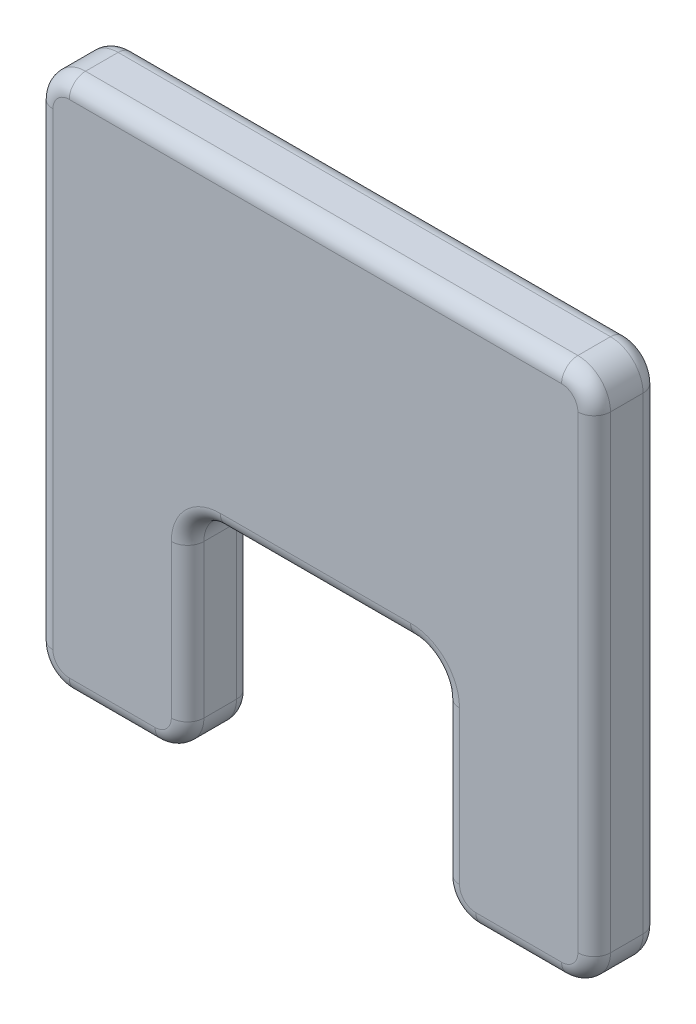
from build123d import *

# Parameters (mm, degrees)
BOSS_EXTRUDE1_DEPTH = 50.8
FILLET1_R           = 25.4
FILLET2_R           = 12.7


with BuildPart() as part:
    # Sketch1 → Boss-Extrude1 (new body)
    with BuildSketch(Plane.XY):
        Polygon((-93.295534025, 185.662148834), (341.304465963, 185.662148834), (341.304465963, -230.262851166), (223.626687979, -230.262851166), (223.626687979, -60.262851166), (24.382243959, -60.262851166), (24.382243959, -230.262851166), (-93.295534025, -230.262851166), align=None)
    extrude(amount=BOSS_EXTRUDE1_DEPTH)

    # Fillet1
    fillet1_edges = [part.edges().sort_by_distance(p)[0] for p in [
        (24.382243959, -230.262851166, 25.4),
        (-93.295534025, -230.262851166, 25.4),
        (-93.295534025, 185.662148834, 25.4),
        (341.304465963, 185.662148834, 25.4),
        (341.304465963, -230.262851166, 25.4),
        (223.626687979, -230.262851166, 25.4),
        (223.626687979, -60.262851166, 25.4),
        (24.382243959, -60.262851166, 25.4),
    ]]
    fillet(fillet1_edges, radius=FILLET1_R)

    # Fillet2
    fillet2_edges = [part.edges().sort_by_distance(p)[0] for p in [
        (31.821731717, -67.702338924, 0),
        (124.004465969, -60.262851166, 0),
        (216.187200221, -67.702338924, 0),
        (223.626687979, -145.262851166, 0),
        (231.066175737, -222.823363409, 0),
        (282.465576971, -230.262851166, 0),
        (333.864978205, -222.823363409, 0),
        (341.304465963, -22.300351166, 0),
        (333.864978205, 178.222661076, 0),
        (124.004465969, 185.662148834, 0),
        (-85.856046267, 178.222661076, 0),
        (-93.295534025, -22.300351166, 0),
        (-85.856046267, -222.823363409, 0),
        (-34.456645033, -230.262851166, 0),
        (16.942756201, -222.823363409, 0),
        (24.382243959, -145.262851166, 0),
        (-85.856046267, -222.823363409, 50.8),
        (-93.295534025, -22.300351166, 50.8),
        (-85.856046267, 178.222661076, 50.8),
        (124.004465969, 185.662148834, 50.8),
        (333.864978205, 178.222661076, 50.8),
        (341.304465963, -22.300351166, 50.8),
        (333.864978205, -222.823363409, 50.8),
        (282.465576971, -230.262851166, 50.8),
        (231.066175737, -222.823363409, 50.8),
        (223.626687979, -145.262851166, 50.8),
        (216.187200221, -67.702338924, 50.8),
        (124.004465969, -60.262851166, 50.8),
        (31.821731717, -67.702338924, 50.8),
        (24.382243959, -145.262851166, 50.8),
        (16.942756201, -222.823363409, 50.8),
        (-34.456645033, -230.262851166, 50.8),
    ]]
    fillet(fillet2_edges, radius=FILLET2_R)


solid = part.part
